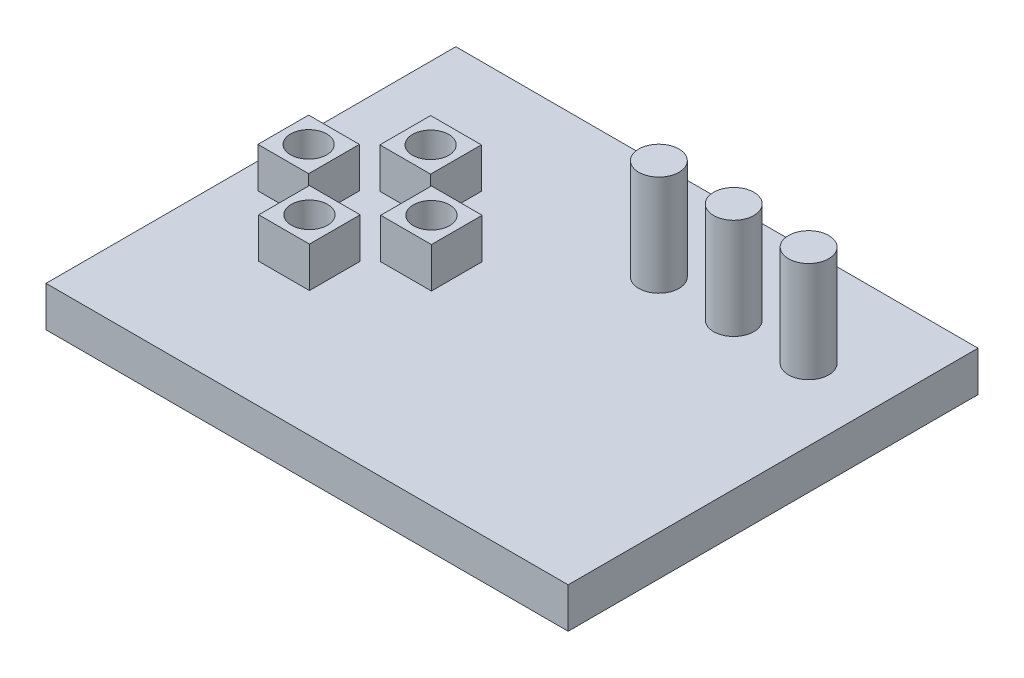
from build123d import *

# Parameters (mm, degrees)
SKETCH1_W           = 64.85
SKETCH1_H           = 50.9
BOSS_EXTRUDE1_DEPTH = 5
SKETCH2_W           = 6.3
SKETCH2_H           = 6.3
SKETCH2_R           = 2.25
BOSS_EXTRUDE2_DEPTH = 5
SKETCH3_R           = 2.5
BOSS_EXTRUDE3_DEPTH = 12.5


with BuildPart() as part:
    # Sketch1 → Boss-Extrude1 (new body)
    with BuildSketch(Plane(origin=(0, 0, 0), x_dir=(1, 0, 0), z_dir=(0, 1, 0))):
        Rectangle(SKETCH1_W, SKETCH1_H)
    extrude(amount=BOSS_EXTRUDE1_DEPTH)

    # Sketch2 → Boss-Extrude2 (add)
    # profile 1 of 4: a face of its own
    with BuildSketch(Plane(origin=(0, 5, 0), x_dir=(1, 0, 0), z_dir=(0, 1, 0))):
        with Locations((-26.061755396, 0.805169379)):
            Rectangle(SKETCH2_W, SKETCH2_H)
        with Locations((-26.061755396, 0.805169379)):
            Circle(SKETCH2_R, mode=Mode.SUBTRACT)
    # profile 2 of 4: a face of its own
    with BuildSketch(Plane(origin=(0, 5, 0), x_dir=(1, 0, 0), z_dir=(0, 1, 0))):
        with Locations((-10.811755396, 0.805169379)):
            Rectangle(SKETCH2_W, SKETCH2_H)
        with Locations((-10.811755396, 0.805169379)):
            Circle(SKETCH2_R, mode=Mode.SUBTRACT)
    # profile 3 of 4: a face of its own
    with BuildSketch(Plane(origin=(0, 5, 0), x_dir=(1, 0, 0), z_dir=(0, 1, 0))):
        with Locations((-18.436755396, 8.330169379)):
            Rectangle(SKETCH2_W, SKETCH2_H)
        with Locations((-18.436755396, 8.330169379)):
            Circle(SKETCH2_R, mode=Mode.SUBTRACT)
    # profile 4 of 4: a face of its own
    with BuildSketch(Plane(origin=(0, 5, 0), x_dir=(1, 0, 0), z_dir=(0, 1, 0))):
        with Locations((-18.436755396, -6.719830621)):
            Rectangle(SKETCH2_W, SKETCH2_H)
        with Locations((-18.436755396, -6.719830621)):
            Circle(SKETCH2_R, mode=Mode.SUBTRACT)
    extrude(amount=BOSS_EXTRUDE2_DEPTH)

    # Sketch3 → Boss-Extrude3 (add)
    with BuildSketch(Plane(origin=(0, 5, 0), x_dir=(1, 0, 0), z_dir=(0, 1, 0))):
        with Locations((4.934190705, 13.305169379)):
            Circle(SKETCH3_R)
        with Locations((14.234190705, 13.305169379)):
            Circle(SKETCH3_R)
        with Locations((23.534190705, 13.305169379)):
            Circle(SKETCH3_R)
    extrude(amount=BOSS_EXTRUDE3_DEPTH)


solid = part.part
